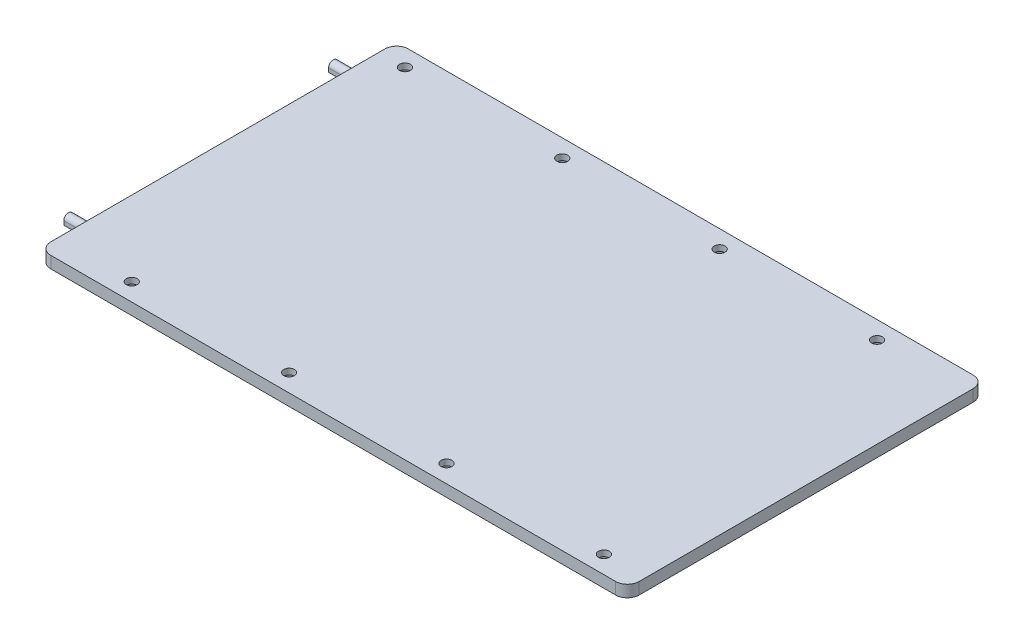
from build123d import *

# Parameters (mm, degrees)
SKETCH1_W           = 300
SKETCH1_H           = 182.3
BOSS_EXTRUDE1_DEPTH = 6
FILLET1_R           = 6
HOLE1_D             = 5.5
HOLE1_DEPTH         = 6
HOLE1_CBORE_D       = 10
HOLE1_CBORE_DEPTH   = 3
HOLE1_TIP           = 1.652366702


with BuildPart() as part:
    # Sketch1 → Boss-Extrude1 (new body)
    with BuildSketch(Plane(origin=(0, 0, 0), x_dir=(1, 0, 0), z_dir=(0, 1, 0))):
        Rectangle(SKETCH1_W, SKETCH1_H)
    extrude(amount=BOSS_EXTRUDE1_DEPTH)

    # Fillet1
    fillet1_edges = [part.edges().sort_by_distance(p)[0] for p in [
        (150, 3, 91.15),
        (-150, 3, 91.15),
        (-150, 3, -91.15),
        (150, 3, -91.15),
    ]]
    fillet(fillet1_edges, radius=FILLET1_R)

    # Hole1
    with Locations(Plane.XZ):
        with Locations((-136.75, -82.15), (-111.75, 82.15), (-31.5, 82.15), (129, 82.15), (-56.5, -82.15), (23.75, -82.15), (104, -82.15), (48.75, 82.15)):
            CounterBoreHole(HOLE1_D / 2, HOLE1_CBORE_D / 2, HOLE1_CBORE_DEPTH, depth=HOLE1_DEPTH)
            with Locations((0, 0, -(HOLE1_DEPTH + HOLE1_TIP / 2))):  # 118° drill point
                Cone(0, HOLE1_D / 2, HOLE1_TIP, mode=Mode.SUBTRACT)

    # Cut-Sweep2: sweep along a path in Sketch15
    with BuildLine(Plane(origin=(0, 0, 0), x_dir=(-1, 0, 0), z_dir=(0, -1, 0))) as cut_sweep2_path:
        Line((160, -66.15), (150, -66.15))
        Line((150, -66.15), (-126.5, -66.15))
        ThreePointArc((-126.5, -66.15), (-140, -52.65), (-126.5, -39.15))
        Line((-126.5, -39.15), (130, -39.15))
        ThreePointArc((130, -39.15), (143.5, -25.65), (130, -12.15))
        Line((130, -12.15), (-126.5, -12.15))
        ThreePointArc((-126.5, -12.15), (-140, 1.35), (-126.5, 14.85))
        Line((-126.5, 14.85), (130, 14.85))
        ThreePointArc((130, 14.85), (143.5, 28.35), (130, 41.85))
        Line((130, 41.85), (-126.5, 41.85))
        ThreePointArc((-126.5, 41.85), (-140, 55.35), (-126.5, 68.85))
        Line((-126.5, 68.85), (150, 68.85))
        Line((150, 68.85), (160, 68.85))
    # Sketch16 → Cut-Sweep2 (sweep, cut)
    with BuildSketch(Plane.ZY.offset(150)):
        with BuildLine():
            Line((68.53125, 2), (68.53125, 0))
            Line((68.53125, 0), (63.76875, 0))
            Line((63.76875, 0), (63.76875, 2))
            ThreePointArc((63.76875, 2), (66.15, 4.38125), (68.53125, 2))
        make_face()
    sweep(path=cut_sweep2_path.line, mode=Mode.SUBTRACT)


with BuildPart() as body_2:
    # Sweep1: sweep along a path in Sketch15<2>
    with BuildLine(Plane(origin=(0, 0, 0), x_dir=(-1, 0, 0), z_dir=(0, -1, 0))) as sweep1_path:
        Line((160, -66.15), (150, -66.15))
        Line((150, -66.15), (-126.5, -66.15))
        ThreePointArc((-126.5, -66.15), (-140, -52.65), (-126.5, -39.15))
        Line((-126.5, -39.15), (130, -39.15))
        ThreePointArc((130, -39.15), (143.5, -25.65), (130, -12.15))
        Line((130, -12.15), (-126.5, -12.15))
        ThreePointArc((-126.5, -12.15), (-140, 1.35), (-126.5, 14.85))
        Line((-126.5, 14.85), (130, 14.85))
        ThreePointArc((130, 14.85), (143.5, 28.35), (130, 41.85))
        Line((130, 41.85), (-126.5, 41.85))
        ThreePointArc((-126.5, 41.85), (-140, 55.35), (-126.5, 68.85))
        Line((-126.5, 68.85), (150, 68.85))
        Line((150, 68.85), (160, 68.85))
    # Sketch17 → Sweep1 (sweep)
    with BuildSketch(Plane.ZY.offset(150)):
        with BuildLine():
            Line((-71.23125, 2), (-71.23125, 0))
            Line((-71.23125, 0), (-66.46875, 0))
            Line((-66.46875, 0), (-66.46875, 2))
            ThreePointArc((-66.46875, 2), (-68.85, 4.38125), (-71.23125, 2))
        make_face()
        with BuildLine():
            Line((-70.46925, 2), (-70.46925, 0.762))
            Line((-70.46925, 0.762), (-67.23075, 0.762))
            Line((-67.23075, 0.762), (-67.23075, 2))
            ThreePointArc((-67.23075, 2), (-68.85, 3.61925), (-70.46925, 2))
        make_face(mode=Mode.SUBTRACT)
    sweep(path=sweep1_path.line)


solid = Compound([part.part, body_2.part])
